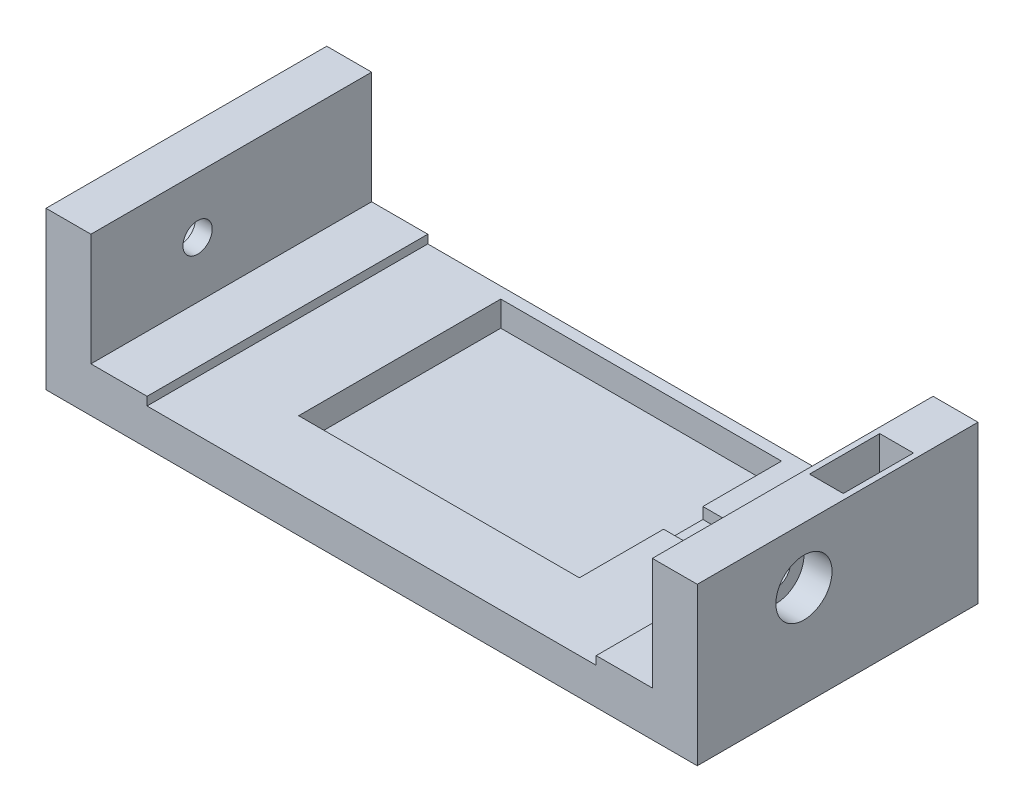
from build123d import *

# Parameters (mm, degrees)
SKETCH_1_W          = 100
SKETCH_1_H          = 50
EXTRUDE_1_DEPTH     = 2
SKETCH_2_W          = 100
SKETCH_2_H          = 50
EXTRUDE_2_DEPTH     = 5
CUT_EXTRUDE_1_DEPTH = 1
SKETCH_5_W          = 25
SKETCH_5_H          = 7
CUT_EXTRUDE_2_DEPTH = 2.5
SKETCH_7_W          = 10
SKETCH_7_H          = 50
EXTRUDE_3_DEPTH     = 1
SKETCH_8_W          = 80
SKETCH_8_H          = 50
CUT_EXTRUDE_3_DEPTH = 0.5
SKETCH_9_W          = 8
SKETCH_9_H          = 50
EXTRUDE_4_DEPTH     = 4.5
SKETCH_10_W         = 8
SKETCH_10_H         = 27
EXTRUDE_5_DEPTH     = 23.5
SKETCH_11_R         = 2.6
CUT_EXTRUDE_4_DEPTH = 23.5
SKETCH_12_R         = 5
CUT_EXTRUDE_5_DEPTH = 5
SKETCH_13_W         = 8
SKETCH_13_H         = 50
EXTRUDE_6_DEPTH     = 28
CUT_EXTRUDE_START   = -3000
SKETCH_14_R         = 2.6
CUT_EXTRUDE_6_DEPTH = 3000
CUT_EXTRUDE_START_2 = -5
SKETCH_15_R         = 5
CUT_EXTRUDE_7_DEPTH = 5
EXTRUDE_8_DEPTH     = 23.5
SKETCH_17_W         = 1
SKETCH_17_H         = 5.5
EXTRUDE_9_DEPTH     = 23.5
SKETCH_18_W         = 1
SKETCH_18_H         = 7
EXTRUDE_10_DEPTH    = 21.5
SKETCH_19_W         = 6
SKETCH_19_H         = 5.5
EXTRUDE_11_DEPTH    = 8
CUT_EXTRUDE_8_DEPTH = 1
FILLET_1_R          = 1
FILLET_2_R          = 1


with BuildPart() as part:
    # 草图1 → 凸台-拉伸1 (new body)
    with BuildSketch(Plane(origin=(0, 0, 0), x_dir=(1, 0, 0), z_dir=(0, 1, 0))):
        Rectangle(SKETCH_1_W, SKETCH_1_H)
    extrude(amount=EXTRUDE_1_DEPTH)

    # 草图2 → 凸台-拉伸2 (add)
    with BuildSketch(Plane(origin=(0, 2, 0), x_dir=(1, 0, 0), z_dir=(0, 1, 0))):
        Rectangle(SKETCH_2_W, SKETCH_2_H)
        Polygon((0, 23), (25, 23), (25, -13), (-25, -13), (-25, 23), align=None, mode=Mode.SUBTRACT)
    extrude(amount=EXTRUDE_2_DEPTH)

    # 草图4 → 切除-拉伸1 (cut)
    # profile 1 of 4: a face of its own
    with BuildSketch(Plane.XZ):
        with BuildLine():
            add(Edge.make_bspline(
                [(-10.79490552, 3.524249664), (-10.797921586, 3.401534333), (-10.803810072, 3.161948275), (-10.837878184, 2.813471062), (-10.900344122, 2.48572734), (-10.991357642, 2.180938727), (-11.101362603, 1.894358097), (-11.242756619, 1.631532901), (-11.404875484, 1.387671917), (-11.594597838, 1.170080338), (-11.79959944, 0.976241837), (-12.008834313, 0.797111796), (-12.227726354, 0.64120556), (-12.454110074, 0.5077289), (-12.686417808, 0.395043652), (-12.925729483, 0.305299518), (-13.171276498, 0.232289181), (-13.340058179, 0.203056463), (-13.42491737, 0.188358986)],
                knots=[0, 0, 0, 0, 1.263754278, 2.467319311, 3.601134061, 4.693396304, 5.739161272, 6.756076667, 7.760175108, 8.74846137, 9.721038298, 10.663686805, 11.582595492, 12.484247723, 13.367068508, 14.237510823, 15.113864698, 16, 16, 16, 16], degree=3))
            Line((-13.42491737, 0.188358986), (-11.274576075, -5.15070134))
            add(Edge.make_bspline(
                [(-11.274576075, -5.15070134), (-11.250186176, -5.19587045), (-11.204444248, -5.280582658), (-11.123358469, -5.391676386), (-11.040598748, -5.483657653), (-10.919804338, -5.570284184), (-10.751618033, -5.639032771), (-10.610274277, -5.649567308), (-10.538717837, -5.654900503)],
                knots=[0, 0, 0, 0, 0.975115193, 1.828775512, 2.611084167, 3.316115347, 4.6412613, 6, 6, 6, 6], degree=3))
            Line((-10.538717837, -5.654900503), (-10.097202895, -5.654900503))
            Line((-10.097202895, -5.654900503), (-10.097202895, -6.178177473))
            Line((-10.097202895, -6.178177473), (-12.157605961, -6.178177473))
            Line((-12.157605961, -6.178177473), (-14.520528525, 0.101146158))
            Line((-14.520528525, 0.101146158), (-16.202100868, 0.101146158))
            Line((-16.202100868, 0.101146158), (-16.202100868, -5.079840917))
            add(Edge.make_bspline(
                [(-16.202100868, -5.079840917), (-16.200467103, -5.124620137), (-16.197340503, -5.210315884), (-16.161118786, -5.32978179), (-16.102188628, -5.431362425), (-16.0214767, -5.515822335), (-15.91904622, -5.575759641), (-15.805103799, -5.624486808), (-15.676383578, -5.650974051), (-15.586266752, -5.653565235), (-15.539828454, -5.654900503)],
                knots=[0, 0, 0, 0, 1.078790235, 2.06452316, 2.979054495, 3.894638226, 4.850613778, 5.824552863, 6.878965611, 8, 8, 8, 8], degree=3))
            Line((-15.539828454, -5.654900503), (-15.098313511, -5.654900503))
            Line((-15.098313511, -5.654900503), (-15.098313511, -6.178177473))
            Line((-15.098313511, -6.178177473), (-18.52686782, -6.178177473))
            Line((-18.52686782, -6.178177473), (-18.52686782, -5.654900503))
            Line((-18.52686782, -5.654900503), (-18.085352877, -5.654900503))
            add(Edge.make_bspline(
                [(-18.085352877, -5.654900503), (-18.028787761, -5.654228083), (-17.92289584, -5.652969289), (-17.779548818, -5.621291225), (-17.65843914, -5.58106359), (-17.568293617, -5.511687084), (-17.49889239, -5.426117829), (-17.454668832, -5.321161224), (-17.425885401, -5.199484223), (-17.424059792, -5.112744518), (-17.423080463, -5.066213913)],
                knots=[0, 0, 0, 0, 1.319183227, 2.469558204, 3.424729584, 4.274820955, 5.091307053, 5.976025123, 6.91425992, 8, 8, 8, 8], degree=3))
            Line((-17.423080463, -5.066213913), (-17.423080463, 5.442931885))
            add(Edge.make_bspline(
                [(-17.423080463, 5.442931885), (-17.424211354, 5.489416959), (-17.42634107, 5.576958556), (-17.453516948, 5.699229199), (-17.499761641, 5.803290397), (-17.56812523, 5.888666381), (-17.659069443, 5.957043926), (-17.778483825, 6.002421061), (-17.923414497, 6.028304809), (-18.028906821, 6.030463447), (-18.085352877, 6.031618475)],
                knots=[0, 0, 0, 0, 1.085062371, 2.043410581, 2.908232547, 3.724209003, 4.573769755, 5.53611061, 6.681640195, 8, 8, 8, 8], degree=3))
            Line((-18.085352877, 6.031618475), (-18.52686782, 6.031618475))
            Line((-18.52686782, 6.031618475), (-18.52686782, 6.554895444))
            Line((-18.52686782, 6.554895444), (-14.329750463, 6.554895444))
            add(Edge.make_bspline(
                [(-14.329750463, 6.554895444), (-14.192498393, 6.553105513), (-13.92568053, 6.54962589), (-13.537588832, 6.514046138), (-13.174475139, 6.453697124), (-12.83329385, 6.373989326), (-12.518982013, 6.26361942), (-12.224924435, 6.136559022), (-11.958520427, 5.979872793), (-11.713242903, 5.803490483), (-11.497731879, 5.599877495), (-11.305622157, 5.375421261), (-11.150257363, 5.122466459), (-11.014689888, 4.850549593), (-10.920713236, 4.55072375), (-10.845145504, 4.230542645), (-10.801654877, 3.885188896), (-10.797201076, 3.647010444), (-10.79490552, 3.524249664)],
                knots=[0, 0, 0, 0, 1.239771442, 2.410114241, 3.516548642, 4.563643912, 5.570731306, 6.522415289, 7.452911504, 8.357454042, 9.245878635, 10.125463721, 11.018086602, 11.921101164, 12.863252417, 13.848771113, 14.891224065, 16, 16, 16, 16], degree=3))
        make_face()
        with BuildLine():
            Line((-16.202100868, 0.624423127), (-14.585938146, 0.624423127))
            add(Edge.make_bspline(
                [(-14.585938146, 0.624423127), (-14.495923492, 0.626700701), (-14.319024915, 0.631176634), (-14.059863149, 0.660904866), (-13.812474258, 0.712615128), (-13.577574702, 0.787118269), (-13.352407753, 0.87940475), (-13.138749706, 0.99462769), (-12.937536039, 1.131296919), (-12.747141995, 1.286717147), (-12.575479569, 1.46663145), (-12.424917346, 1.670054043), (-12.295274862, 1.895269526), (-12.191797102, 2.145491944), (-12.114044601, 2.419287671), (-12.05752946, 2.714761959), (-12.020782145, 3.03275656), (-12.017554558, 3.252510489), (-12.015885115, 3.366176413)],
                knots=[0, 0, 0, 0, 1.012637294, 1.990054818, 2.930157669, 3.851404925, 4.758656292, 5.66406365, 6.576824691, 7.491529117, 8.424045871, 9.366368305, 10.332337305, 11.340218466, 12.404359511, 13.528827041, 14.721805983, 16, 16, 16, 16], degree=3))
            add(Edge.make_bspline(
                [(-12.015885115, 3.366176413), (-12.018112497, 3.467997876), (-12.022457907, 3.666641846), (-12.052362224, 3.95654099), (-12.103005663, 4.229569517), (-12.177900981, 4.484425203), (-12.268952653, 4.72301575), (-12.385245432, 4.942185808), (-12.519143162, 5.145745365), (-12.673995817, 5.332136521), (-12.853793878, 5.496312011), (-13.052563378, 5.642522552), (-13.277535928, 5.762012516), (-13.523201007, 5.864304065), (-13.794568502, 5.938709356), (-14.08722105, 5.992849709), (-14.402581213, 6.025944266), (-14.620377201, 6.029683186), (-14.733109793, 6.031618475)],
                knots=[0, 0, 0, 0, 1.12204793, 2.189008577, 3.208110042, 4.177663374, 5.112852195, 6.017476157, 6.906057134, 7.794412469, 8.680055607, 9.583237936, 10.506126784, 11.48037282, 12.510431628, 13.600258316, 14.757878393, 16, 16, 16, 16], degree=3))
            Line((-14.733109793, 6.031618475), (-15.539828454, 6.031618475))
            add(Edge.make_bspline(
                [(-15.539828454, 6.031618475), (-15.586351508, 6.030622816), (-15.676831348, 6.028686421), (-15.80459036, 5.997489319), (-15.920016895, 5.950497337), (-16.020583786, 5.886633435), (-16.103185431, 5.802450952), (-16.160958337, 5.698024035), (-16.197630489, 5.575247007), (-16.200557687, 5.486822671), (-16.202100868, 5.440206484)],
                knots=[0, 0, 0, 0, 1.107148234, 2.153224812, 3.115099798, 4.07085203, 4.975094505, 5.897081521, 6.891368079, 8, 8, 8, 8], degree=3))
            Line((-16.202100868, 5.440206484), (-16.202100868, 0.624423127))
        make_face(mode=Mode.SUBTRACT)
    # profile 2 of 4: a face of its own
    with BuildSketch(Plane.XZ):
        with BuildLine():
            Line((-5.780167899, -5.654900503), (-5.780167899, -6.178177473))
            Line((-5.780167899, -6.178177473), (-9.355893855, -6.178177473))
            Line((-9.355893855, -6.178177473), (-9.355893855, -5.654900503))
            Line((-9.355893855, -5.654900503), (-8.840793088, -5.654900503))
            add(Edge.make_bspline(
                [(-8.840793088, -5.654900503), (-8.784227972, -5.654228083), (-8.678336051, -5.652969289), (-8.534989029, -5.621291225), (-8.413879351, -5.58106359), (-8.323733828, -5.511687084), (-8.254332601, -5.426117829), (-8.210109044, -5.321161224), (-8.181325613, -5.199484223), (-8.179500003, -5.112744518), (-8.178520674, -5.066213913)],
                knots=[0, 0, 0, 0, 1.319183227, 2.469558204, 3.424729584, 4.274820955, 5.091307053, 5.976025123, 6.91425992, 8, 8, 8, 8], degree=3))
            Line((-8.178520674, -5.066213913), (-8.178520674, 5.442931885))
            add(Edge.make_bspline(
                [(-8.178520674, 5.442931885), (-8.179651565, 5.489416959), (-8.181781281, 5.576958556), (-8.208957159, 5.699229199), (-8.255201852, 5.803290397), (-8.323565441, 5.888666381), (-8.414509654, 5.957043926), (-8.533924036, 6.002421061), (-8.678854708, 6.028304809), (-8.784347032, 6.030463447), (-8.840793088, 6.031618475)],
                knots=[0, 0, 0, 0, 1.085062371, 2.043410581, 2.908232547, 3.724209003, 4.573769755, 5.53611061, 6.681640195, 8, 8, 8, 8], degree=3))
            Line((-8.840793088, 6.031618475), (-9.282308031, 6.031618475))
            Line((-9.282308031, 6.031618475), (-9.282308031, 6.554895444))
            Line((-9.282308031, 6.554895444), (-1.569423537, 6.554895444))
            Line((-1.569423537, 6.554895444), (-0.678217449, 3.764084942))
            Line((-0.678217449, 3.764084942), (-1.046146568, 3.589659285))
            add(Edge.make_bspline(
                [(-1.046146568, 3.589659285), (-1.095968562, 3.689248278), (-1.193142675, 3.883489239), (-1.35365139, 4.159546127), (-1.5147047, 4.41929283), (-1.688603782, 4.657323848), (-1.866571942, 4.877758811), (-2.054061382, 5.078146762), (-2.245799855, 5.260848508), (-2.509613657, 5.472892515), (-2.852537403, 5.69765986), (-3.292928233, 5.889287638), (-3.752392295, 6.010330092), (-4.06606544, 6.024490386), (-4.223963996, 6.031618475)],
                knots=[0, 0, 0, 0, 0.94578944, 1.844692316, 2.711890907, 3.540916882, 4.347324321, 5.11730508, 5.870746203, 6.595166858, 7.990988299, 9.338873143, 10.66042696, 12, 12, 12, 12], degree=3))
            Line((-4.223963996, 6.031618475), (-6.292543264, 6.031618475))
            add(Edge.make_bspline(
                [(-6.292543264, 6.031618475), (-6.338998117, 6.030306726), (-6.429147069, 6.027761182), (-6.557643043, 6.000955351), (-6.67281227, 5.953140921), (-6.773377531, 5.888564784), (-6.85788362, 5.8065516), (-6.916394996, 5.703591127), (-6.953088679, 5.58348173), (-6.956003426, 5.49682382), (-6.957541079, 5.451108087)],
                knots=[0, 0, 0, 0, 1.114207019, 2.16219814, 3.130205701, 4.09205147, 5.017350036, 5.926311656, 6.906041229, 8, 8, 8, 8], degree=3))
            Line((-6.957541079, 5.451108087), (-6.957541079, 0.798848783))
            Line((-6.957541079, 0.798848783), (-4.521032692, 0.798848783))
            add(Edge.make_bspline(
                [(-4.521032692, 0.798848783), (-4.40631678, 0.802945293), (-4.192345428, 0.810586219), (-3.894112765, 0.868067513), (-3.646575032, 0.971370898), (-3.444207927, 1.117055325), (-3.295598222, 1.316595519), (-3.188693595, 1.561156109), (-3.132303812, 1.85655636), (-3.124400303, 2.067759371), (-3.120176639, 2.18062703)],
                knots=[0, 0, 0, 0, 1.209264211, 2.255553698, 3.182449537, 4.017664171, 4.851009454, 5.772943287, 6.809852772, 8, 8, 8, 8], degree=3))
            Line((-3.120176639, 2.18062703), (-3.120176639, 2.543105347))
            Line((-3.120176639, 2.543105347), (-2.59689967, 2.543105347))
            Line((-2.59689967, 2.543105347), (-2.59689967, -1.817536063))
            Line((-2.59689967, -1.817536063), (-3.120176639, -1.817536063))
            Line((-3.120176639, -1.817536063), (-3.120176639, -1.517741966))
            add(Edge.make_bspline(
                [(-3.120176639, -1.517741966), (-3.1245008, -1.377676055), (-3.132632781, -1.11426928), (-3.188221407, -0.744711597), (-3.294912172, -0.43241977), (-3.439443614, -0.171205185), (-3.637297778, 0.03412476), (-3.888402945, 0.177768595), (-4.18945229, 0.263477149), (-4.405954831, 0.271374256), (-4.521032692, 0.275571814)],
                knots=[0, 0, 0, 0, 1.289078804, 2.424230758, 3.423516422, 4.311067377, 5.150507959, 6.012172085, 6.943407391, 8, 8, 8, 8], degree=3))
            Line((-4.521032692, 0.275571814), (-6.957541079, 0.275571814))
            Line((-6.957541079, 0.275571814), (-6.957541079, -5.068939314))
            add(Edge.make_bspline(
                [(-6.957541079, -5.068939314), (-6.956170248, -5.11561251), (-6.953595648, -5.203270832), (-6.915088297, -5.325295668), (-6.859465074, -5.430611484), (-6.776715115, -5.515710194), (-6.674542461, -5.575790778), (-6.560527589, -5.624477682), (-6.431828343, -5.650976581), (-6.341708511, -5.653566095), (-6.295268665, -5.654900503)],
                knots=[0, 0, 0, 0, 1.111159639, 2.086902041, 3.029942388, 3.936246567, 4.88253319, 5.846601284, 6.890327431, 8, 8, 8, 8], degree=3))
            Line((-6.295268665, -5.654900503), (-5.780167899, -5.654900503))
        make_face()
    # profile 3 of 4: a face of its own
    with BuildSketch(Plane.XZ):
        with BuildLine():
            Line((1.502103256, 6.031618475), (1.502103256, 6.554895444))
            Line((1.502103256, 6.554895444), (7.432575573, 6.554895444))
            Line((7.432575573, 6.554895444), (7.432575573, 6.031618475))
            Line((7.432575573, 6.031618475), (5.740101626, 6.031618475))
            add(Edge.make_bspline(
                [(5.740101626, 6.031618475), (5.693650346, 6.030302914), (5.603508328, 6.027749975), (5.474963956, 6.000995771), (5.359962566, 5.953002305), (5.259333899, 5.889414167), (5.176747953, 5.805161604), (5.11897078, 5.700753735), (5.082299873, 5.57797115), (5.07937249, 5.489547638), (5.077829212, 5.442931885)],
                knots=[0, 0, 0, 0, 1.107802495, 2.149769703, 3.112213102, 4.068530129, 4.973306959, 5.895838817, 6.890712941, 8, 8, 8, 8], degree=3))
            Line((5.077829212, 5.442931885), (5.077829212, -5.066213913))
            add(Edge.make_bspline(
                [(5.077829212, -5.066213913), (5.07919575, -5.112894748), (5.081762287, -5.200567415), (5.120323891, -5.322495727), (5.175755821, -5.42815188), (5.259547029, -5.512365766), (5.359245724, -5.577200515), (5.476051816, -5.619925855), (5.602993304, -5.652225308), (5.693542771, -5.653992068), (5.740101626, -5.654900503)],
                knots=[0, 0, 0, 0, 1.110011957, 2.084746545, 3.026812855, 3.932180941, 4.889122902, 5.844094832, 6.891473577, 8, 8, 8, 8], degree=3))
            Line((5.740101626, -5.654900503), (7.432575573, -5.654900503))
            Line((7.432575573, -5.654900503), (7.432575573, -6.178177473))
            Line((7.432575573, -6.178177473), (1.502103256, -6.178177473))
            Line((1.502103256, -6.178177473), (1.502103256, -5.654900503))
            Line((1.502103256, -5.654900503), (3.194577203, -5.654900503))
            add(Edge.make_bspline(
                [(3.194577203, -5.654900503), (3.251142319, -5.654228083), (3.35703424, -5.652969289), (3.500381262, -5.621291225), (3.62149094, -5.58106359), (3.711636463, -5.511687084), (3.78103769, -5.426117829), (3.825261247, -5.321161224), (3.854044679, -5.199484223), (3.855870288, -5.112744518), (3.856849617, -5.066213913)],
                knots=[0, 0, 0, 0, 1.319183227, 2.469558204, 3.424729584, 4.274820955, 5.091307053, 5.976025123, 6.91425992, 8, 8, 8, 8], degree=3))
            Line((3.856849617, -5.066213913), (3.856849617, 5.442931885))
            add(Edge.make_bspline(
                [(3.856849617, 5.442931885), (3.855718726, 5.489416959), (3.85358901, 5.576958556), (3.826413132, 5.699229199), (3.780168439, 5.803290397), (3.71180485, 5.888666381), (3.620860637, 5.957043926), (3.501446255, 6.002421061), (3.356515583, 6.028304809), (3.251023259, 6.030463447), (3.194577203, 6.031618475)],
                knots=[0, 0, 0, 0, 1.085062371, 2.043410581, 2.908232547, 3.724209003, 4.573769755, 5.53611061, 6.681640195, 8, 8, 8, 8], degree=3))
            Line((3.194577203, 6.031618475), (1.502103256, 6.031618475))
        make_face()
    # profile 4 of 4: a face of its own
    with BuildSketch(Plane.XZ):
        with BuildLine():
            add(Edge.make_bspline(
                [(10.659450216, 5.442931885), (10.657356199, 5.489417866), (10.65340568, 5.577117138), (10.624224958, 5.700256642), (10.571442694, 5.803731232), (10.49739524, 5.889740414), (10.396925149, 5.958241521), (10.265404771, 6.001939603), (10.105477428, 6.02862365), (9.989132574, 6.030568461), (9.926317379, 6.031618475)],
                knots=[0, 0, 0, 0, 1.027906949, 1.939223141, 2.77497046, 3.572652929, 4.425377539, 5.429642147, 6.612250338, 8, 8, 8, 8], degree=3))
            Line((9.926317379, 6.031618475), (9.438470621, 6.031618475))
            Line((9.438470621, 6.031618475), (9.438470621, 6.554895444))
            Line((9.438470621, 6.554895444), (12.771635899, 6.554895444))
            add(Edge.make_bspline(
                [(12.771635899, 6.554895444), (12.958060696, 6.549860405), (13.323095766, 6.540001386), (13.85660407, 6.472383698), (14.361324045, 6.354469538), (14.837714155, 6.191294746), (15.284957058, 5.980541308), (15.702208384, 5.721958887), (16.090968173, 5.41803826), (16.449946416, 5.067633503), (16.774512328, 4.668281699), (17.05144892, 4.213932715), (17.290956212, 3.712595878), (17.479328203, 3.157356799), (17.62835475, 2.55273121), (17.737193165, 1.896872061), (17.798367684, 1.189754297), (17.806636254, 0.701760473), (17.810902128, 0.44999747)],
                knots=[0, 0, 0, 0, 0.993846272, 1.946032661, 2.861223658, 3.752666048, 4.625789266, 5.491384141, 6.364332706, 7.251409296, 8.160621319, 9.10014679, 10.081546929, 11.116985468, 12.220018703, 13.398460325, 14.657828424, 16, 16, 16, 16], degree=3))
            add(Edge.make_bspline(
                [(17.810902128, 0.44999747), (17.806474754, 0.17372221), (17.797914841, -0.360430197), (17.739306094, -1.133448776), (17.636700829, -1.849268276), (17.493337022, -2.508283824), (17.310412399, -3.111812689), (17.079393139, -3.656493696), (16.815430018, -4.149508731), (16.499890857, -4.580449273), (16.149701265, -4.961522309), (15.755900379, -5.287211503), (15.325652876, -5.565019421), (14.854397422, -5.789341978), (14.344797012, -5.963504841), (13.796649314, -6.08744482), (13.209973984, -6.166026094), (12.805510297, -6.174046789), (12.597210243, -6.178177473)],
                knots=[0, 0, 0, 0, 1.373967773, 2.656438328, 3.852557549, 4.967431126, 6.007803661, 6.983716522, 7.905723204, 8.782332933, 9.632738224, 10.473268643, 11.31670832, 12.173534382, 13.062250844, 13.989456761, 14.964563993, 16, 16, 16, 16], degree=3))
            Line((12.597210243, -6.178177473), (9.438470621, -6.178177473))
            Line((9.438470621, -6.178177473), (9.438470621, -5.654900503))
            Line((9.438470621, -5.654900503), (9.972649194, -5.654900503))
            add(Edge.make_bspline(
                [(9.972649194, -5.654900503), (10.031968021, -5.65439361), (10.141525679, -5.653457414), (10.28994686, -5.620608953), (10.415159277, -5.581834687), (10.508329686, -5.511660993), (10.581418911, -5.427109946), (10.624207162, -5.320631472), (10.657709002, -5.199987126), (10.658843265, -5.112844512), (10.659450216, -5.066213913)],
                knots=[0, 0, 0, 0, 1.355767813, 2.504006799, 3.479513298, 4.329705293, 5.143368754, 6.010748294, 6.93553804, 8, 8, 8, 8], degree=3))
            Line((10.659450216, -5.066213913), (10.659450216, 5.442931885))
        make_face()
        with BuildLine():
            add(Edge.make_bspline(
                [(16.415496877, 0.297375021), (16.41329214, 0.550904878), (16.409045025, 1.039294388), (16.365397827, 1.742418817), (16.293593665, 2.387740196), (16.19082954, 2.974017952), (16.06186841, 3.503260258), (15.902702328, 3.974062151), (15.712712881, 4.387541111), (15.489557838, 4.743053426), (15.241415147, 5.048677182), (14.973150837, 5.312752812), (14.681926339, 5.536738333), (14.36557504, 5.716630011), (14.028469289, 5.860099556), (13.668473622, 5.960326271), (13.286154278, 6.022088239), (13.023523265, 6.028387687), (12.888828137, 6.031618475)],
                knots=[0, 0, 0, 0, 1.59646395, 3.075362622, 4.434367349, 5.683484594, 6.821308091, 7.861634077, 8.808656942, 9.680117819, 10.497685445, 11.282550499, 12.045786037, 12.804375787, 13.568382876, 14.347177407, 15.152319638, 16, 16, 16, 16], degree=3))
            add(Edge.make_bspline(
                [(12.888828137, 6.031618475), (12.809695807, 6.030528466), (12.661783124, 6.028491042), (12.455086664, 6.001507138), (12.278996906, 5.957275535), (12.13440487, 5.892205039), (12.020060566, 5.808953985), (11.937291966, 5.705103558), (11.889288501, 5.579358422), (11.8834651, 5.489676272), (11.880429811, 5.442931885)],
                knots=[0, 0, 0, 0, 1.445626457, 2.702138146, 3.801811208, 4.752888274, 5.583214569, 6.363897933, 7.147226193, 8, 8, 8, 8], degree=3))
            Line((11.880429811, 5.442931885), (11.880429811, -5.066213913))
            add(Edge.make_bspline(
                [(11.880429811, -5.066213913), (11.882459399, -5.113020208), (11.88629269, -5.201423433), (11.931283585, -5.323442864), (11.995287193, -5.431764827), (12.096438, -5.512147567), (12.213430631, -5.579507638), (12.352916077, -5.619305857), (12.506596379, -5.652856691), (12.616057192, -5.654196917), (12.673521467, -5.654900503)],
                knots=[0, 0, 0, 0, 1.000597573, 1.889832393, 2.767414519, 3.667516155, 4.629057484, 5.654123158, 6.76847148, 8, 8, 8, 8], degree=3))
            add(Edge.make_bspline(
                [(12.673521467, -5.654900503), (12.80273044, -5.651308589), (13.057901824, -5.644215013), (13.432718667, -5.5856796), (13.791259494, -5.489467394), (14.135584959, -5.359430345), (14.460183577, -5.185011007), (14.772064031, -4.97671496), (15.064819924, -4.726673173), (15.297713865, -4.492528025), (15.471886167, -4.280547654), (15.593161392, -4.099880726), (15.709402859, -3.903512473), (15.810408107, -3.686449391), (15.91099661, -3.455257426), (15.995760276, -3.202567632), (16.078867033, -2.934356626), (16.148643536, -2.646408619), (16.211395448, -2.34098109), (16.265286318, -2.017263198), (16.311668253, -1.675534466), (16.349607495, -1.315606144), (16.378995295, -0.93753096), (16.40177178, -0.541390721), (16.410942588, -0.12782759), (16.413959451, 0.153836116), (16.415496877, 0.297375021)],
                knots=[0, 0, 0, 0, 1.166582381, 2.303852706, 3.416464483, 4.515161786, 5.62000061, 6.7374129, 7.896235737, 9.091524164, 9.715620606, 10.371077895, 11.055036676, 11.774356386, 12.531791278, 13.331049961, 14.179863321, 15.067451511, 16.005634718, 16.995772484, 18.030890105, 19.120078429, 20.264195575, 21.455788781, 22.703442139, 24, 24, 24, 24], degree=3))
        make_face(mode=Mode.SUBTRACT)
    extrude(amount=-CUT_EXTRUDE_1_DEPTH, mode=Mode.SUBTRACT)

    # 草图5 → 切除-拉伸2 (cut)
    with BuildSketch(Plane(origin=(0, 7, 0), x_dir=(1, 0, 0), z_dir=(0, 1, 0))):
        with Locations((37.5, 5.5)):
            Rectangle(SKETCH_5_W, SKETCH_5_H)
    extrude(amount=-CUT_EXTRUDE_2_DEPTH, mode=Mode.SUBTRACT)

    # 草图7 → 凸台-拉伸3 (add)
    with BuildSketch(Plane(origin=(0, 7, 0), x_dir=(1, 0, 0), z_dir=(0, 1, 0))):
        with Locations((45, 0)):
            Rectangle(SKETCH_7_W, SKETCH_7_H)
        with Locations((-45, 0)):
            Rectangle(SKETCH_7_W, SKETCH_7_H)
    extrude(amount=EXTRUDE_3_DEPTH)

    # 草图8 → 切除-拉伸3 (cut)
    with BuildSketch(Plane(origin=(0, 7, 0), x_dir=(1, 0, 0), z_dir=(0, 1, 0))):
        Rectangle(SKETCH_8_W, SKETCH_8_H)
    extrude(amount=-CUT_EXTRUDE_3_DEPTH, mode=Mode.SUBTRACT)

    # 草图9 → 凸台-拉伸4 (add)
    with BuildSketch(Plane.XZ):
        with Locations((54, 0)):
            Rectangle(SKETCH_9_W, SKETCH_9_H)
    extrude(amount=-EXTRUDE_4_DEPTH)

    # 草图10 → 凸台-拉伸5 (add)
    with BuildSketch(Plane(origin=(0, 4.5, 0), x_dir=(1, 0, 0), z_dir=(0, 1, 0))):
        with Locations((54, -11.5)):
            Rectangle(SKETCH_10_W, SKETCH_10_H)
    extrude(amount=EXTRUDE_5_DEPTH)

    # 草图11 → 切除-拉伸4 (cut)
    with BuildSketch(Plane.ZY.offset(-50)):
        with Locations((6, 18)):
            Circle(SKETCH_11_R)
    extrude(amount=-CUT_EXTRUDE_4_DEPTH, mode=Mode.SUBTRACT)

    # 草图12 → 切除-拉伸5 (cut)
    with BuildSketch(Plane(origin=(58, 0, 0), x_dir=(0, 0, -1), z_dir=(1, 0, 0))):
        with Locations((-6, 18)):
            Circle(SKETCH_12_R)
    extrude(amount=-CUT_EXTRUDE_5_DEPTH, mode=Mode.SUBTRACT)

    # 草图13 → 凸台-拉伸6 (add)
    with BuildSketch(Plane.XZ):
        with Locations((-54, 0)):
            Rectangle(SKETCH_13_W, SKETCH_13_H)
    extrude(amount=-EXTRUDE_6_DEPTH)

    # 草图14 → 切除-拉伸6 (cut)
    with BuildSketch(Plane(origin=(53, 0, 0), x_dir=(0, 0, -1), z_dir=(1, 0, 0)).offset(CUT_EXTRUDE_START)):
        with Locations(Location((-6, 18, 0), (0, 0, 180))):
            Circle(SKETCH_14_R)
    extrude(amount=CUT_EXTRUDE_6_DEPTH, mode=Mode.SUBTRACT)

    # 草图15 → 切除-拉伸7 (cut)
    with BuildSketch(Plane.ZY.offset(58).offset(CUT_EXTRUDE_START_2)):
        with Locations(Location((6, 18, 0), (0, 0, 180))):
            Circle(SKETCH_15_R)
    extrude(amount=CUT_EXTRUDE_7_DEPTH, mode=Mode.SUBTRACT)

    # 草图16 → 凸台-拉伸8 (add)
    with BuildSketch(Plane(origin=(0, 4.5, 0), x_dir=(1, 0, 0), z_dir=(0, 1, 0))):
        Polygon((58, 25), (50, 25), (50, 14.5), (51, 14.5), (54, 14.5), (57, 14.5), (57, 2), (58, 2), align=None)
    extrude(amount=EXTRUDE_8_DEPTH)

    # 草图17 → 凸台-拉伸9 (add)
    with BuildSketch(Plane(origin=(0, 4.5, 0), x_dir=(1, 0, 0), z_dir=(0, 1, 0))):
        with Locations((50.5, 11.75)):
            Rectangle(SKETCH_17_W, SKETCH_17_H)
    extrude(amount=EXTRUDE_9_DEPTH)

    # 草图18 → 凸台-拉伸10 (add)
    with BuildSketch(Plane(origin=(0, 28, 0), x_dir=(1, 0, 0), z_dir=(0, 1, 0))):
        with Locations((50.5, 5.5)):
            Rectangle(SKETCH_18_W, SKETCH_18_H)
    extrude(amount=-EXTRUDE_10_DEPTH)

    # 草图19 → 凸台-拉伸11 (add)
    with BuildSketch(Plane(origin=(0, 4.5, 0), x_dir=(1, 0, 0), z_dir=(0, 1, 0))):
        with Locations((54, 11.75)):
            Rectangle(SKETCH_19_W, SKETCH_19_H)
    extrude(amount=EXTRUDE_11_DEPTH)

    # 草图20 → 切除-拉伸8 (cut)
    with BuildSketch(Plane(origin=(0, 0, 0), x_dir=(-1, 0, 0), z_dir=(0, -1, 0))):
        with BuildLine():
            Line((45.105245798, -16.41696688), (43.225860556, -15.732926593))
            ThreePointArc((43.225860556, -15.732926593), (46, 0), (43.225860556, 15.732926593))
            Line((43.225860556, 15.732926593), (45.105245798, 16.41696688))
            ThreePointArc((45.105245798, 16.41696688), (48, 0), (45.105245798, -16.41696688))
        make_face()
        with BuildLine():
            Line((37.587704831, -13.680805733), (35.70831959, -12.996765446))
            ThreePointArc((35.70831959, -12.996765446), (38, 0), (35.70831959, 12.996765446))
            Line((35.70831959, 12.996765446), (37.587704831, 13.680805733))
            ThreePointArc((37.587704831, 13.680805733), (40, 0), (37.587704831, -13.680805733))
        make_face()
        with BuildLine():
            Line((30.070163865, -10.944644586), (28.190778624, -10.2606043))
            ThreePointArc((28.190778624, -10.2606043), (30, 0), (28.190778624, 10.2606043))
            Line((28.190778624, 10.2606043), (30.070163865, 10.944644586))
            ThreePointArc((30.070163865, 10.944644586), (32, 0), (30.070163865, -10.944644586))
        make_face()
        with BuildLine():
            Line((-45.105245798, -16.41696688), (-43.225860556, -15.732926593))
            ThreePointArc((-43.225860556, -15.732926593), (-46, 0), (-43.225860556, 15.732926593))
            Line((-43.225860556, 15.732926593), (-45.105245798, 16.41696688))
            ThreePointArc((-45.105245798, 16.41696688), (-48, 0), (-45.105245798, -16.41696688))
        make_face()
        with BuildLine():
            Line((-37.587704831, -13.680805733), (-35.70831959, -12.996765446))
            ThreePointArc((-35.70831959, -12.996765446), (-38, 0), (-35.70831959, 12.996765446))
            Line((-35.70831959, 12.996765446), (-37.587704831, 13.680805733))
            ThreePointArc((-37.587704831, 13.680805733), (-40, 0), (-37.587704831, -13.680805733))
        make_face()
        with BuildLine():
            Line((-30.070163865, -10.944644586), (-28.190778624, -10.2606043))
            ThreePointArc((-28.190778624, -10.2606043), (-30, 0), (-28.190778624, 10.2606043))
            Line((-28.190778624, 10.2606043), (-30.070163865, 10.944644586))
            ThreePointArc((-30.070163865, 10.944644586), (-32, 0), (-30.070163865, -10.944644586))
        make_face()
    extrude(amount=-CUT_EXTRUDE_8_DEPTH, mode=Mode.SUBTRACT)

    # 圆角1
    fillet_1_edges = [part.edges().sort_by_distance(p)[0] for p in [
        (-30.070163865, 0.5, -10.944644586),
        (-28.190778624, 0.5, -10.2606043),
        (-35.70831959, 0.5, -12.996765446),
        (-37.587704831, 0.5, -13.680805733),
        (-45.105245798, 0.5, -16.41696688),
        (-43.225860556, 0.5, -15.732926593),
        (-30.070163865, 0.5, 10.944644586),
        (-28.190778624, 0.5, 10.2606043),
        (-35.70831959, 0.5, 12.996765446),
        (-37.587704831, 0.5, 13.680805733),
        (-43.225860556, 0.5, 15.732926593),
        (-45.105245798, 0.5, 16.41696688),
    ]]
    fillet(fillet_1_edges, radius=FILLET_1_R - 0.0001)  # a hair under: the kernel refuses the full size

    # 圆角2
    fillet_2_edges = [part.edges().sort_by_distance(p)[0] for p in [
        (45.105245798, 0.5, -16.41696688),
        (43.225860556, 0.5, -15.732926593),
        (35.70831959, 0.5, -12.996765446),
        (37.587704831, 0.5, -13.680805733),
        (30.070163865, 0.5, -10.944644586),
        (28.190778624, 0.5, -10.2606043),
        (45.105245798, 0.5, 16.41696688),
        (43.225860556, 0.5, 15.732926593),
        (35.70831959, 0.5, 12.996765446),
        (37.587704831, 0.5, 13.680805733),
        (30.070163865, 0.5, 10.944644586),
        (28.190778624, 0.5, 10.2606043),
    ]]
    fillet(fillet_2_edges, radius=FILLET_2_R - 0.0001)  # a hair under: the kernel refuses the full size


solid = part.part
